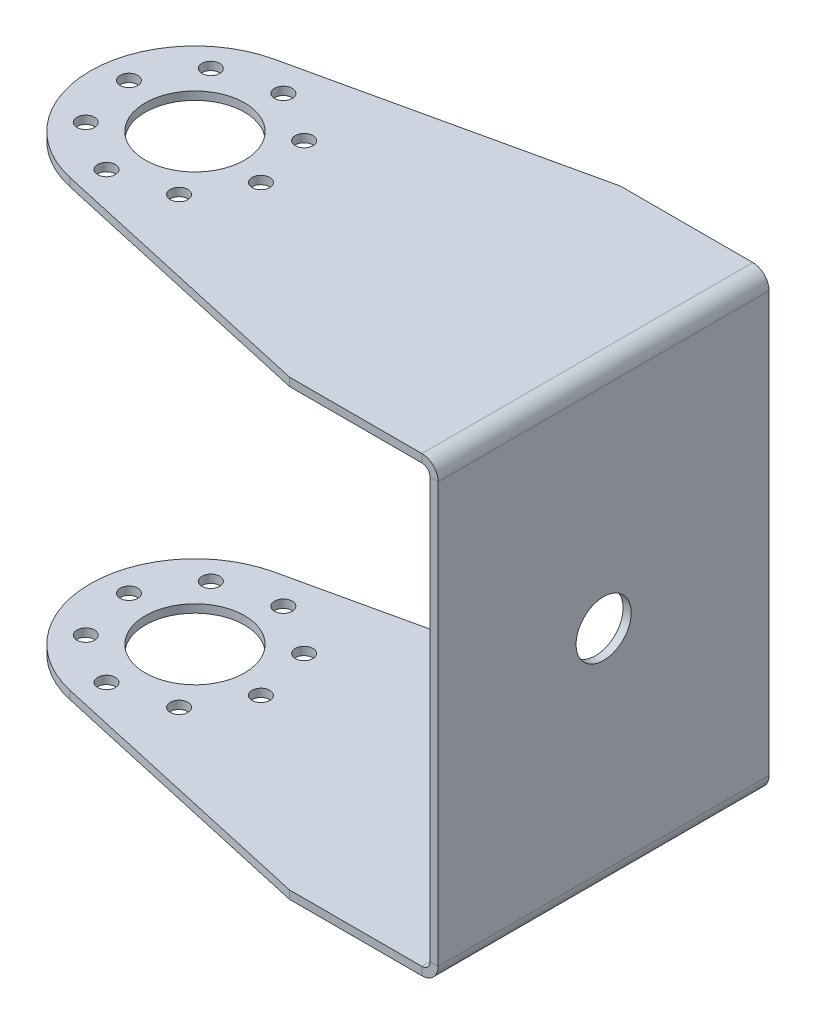
from build123d import *

# Parameters (mm, degrees)
T_LE_DE_BASE_PLI_E1_DEPTH = 30
ESQUISSE13_R              = 4.5
ESQUISSE13_R_2            = 0.8
ENL_V_MAT_EXTRU_2_DEPTH   = 72.281133549
SKETCH1_R                 = 2.5
CUT_EXTRUDE1_DEPTH        = 60.052053397


# Sheet-metal steps are written as plain solids
with BuildPart() as part:
    # Esquisse1 → Tôle de base pliée1 (new body)
    with BuildSketch(Plane.XY):
        with BuildLine():
            Line((-50, 20.5), (-1.4732, 20.5))
            ThreePointArc((-1.4732, 20.5), (-0.43149029, 20.06850971), (0, 19.0268))
            Line((0, 19.0268), (0, -19.0268))
            ThreePointArc((0, -19.0268), (-0.43149029, -20.06850971), (-1.4732, -20.5))
            Line((-1.4732, -20.5), (-50, -20.5))
            Line((-50, -20.5), (-50, -19.7634))
            Line((-50, -19.7634), (-1.4732, -19.7634))
            ThreePointArc((-1.4732, -19.7634), (-0.952345145, -19.547654855), (-0.7366, -19.0268))
            Line((-0.7366, -19.0268), (-0.7366, 19.0268))
            ThreePointArc((-0.7366, 19.0268), (-0.952345145, 19.547654855), (-1.4732, 19.7634))
            Line((-1.4732, 19.7634), (-50, 19.7634))
            Line((-50, 19.7634), (-50, 20.5))
        make_face()
    extrude(amount=T_LE_DE_BASE_PLI_E1_DEPTH)

    # Esquisse13 → Enlèv. mat.-Extru.2 (cut, through all)
    with BuildSketch(Plane.XZ.offset(20.5)):
        with BuildLine():
            ThreePointArc((-46.549919552, 15), (-44.463516741, 20.940418901), (-39.120745506, 24.271552182))
            Line((-39.120745506, 24.271552182), (-13.4732, 30))
            Line((-13.4732, 30), (-50, 30))
            Line((-50, 30), (-50, 15))
            Line((-50, 15), (-46.549919552, 15))
        make_face()
        with BuildLine():
            Line((-13.4732, 0), (-39.120745506, 5.728447818))
            ThreePointArc((-39.120745506, 5.728447818), (-44.463516741, 9.059581099), (-46.549919552, 15))
            Line((-46.549919552, 15), (-50, 15))
            Line((-50, 15), (-50, 0))
            Line((-50, 0), (-13.4732, 0))
        make_face()
        with Locations((-37.049919552, 15)):
            Circle(ESQUISSE13_R)
        with Locations((-30.049919552, 16.017866465)):
            Circle(ESQUISSE13_R_2)
        with Locations((-32.819912364, 20.669487748)):
            Circle(ESQUISSE13_R_2)
        with Locations((-38.067786017, 22)):
            Circle(ESQUISSE13_R_2)
        with Locations((-42.7194073, 19.230007189)):
            Circle(ESQUISSE13_R_2)
        with Locations((-44.049919552, 13.982133535)):
            Circle(ESQUISSE13_R_2)
        with Locations((-41.279926741, 9.330512252)):
            Circle(ESQUISSE13_R_2)
        with Locations((-36.032053088, 8)):
            Circle(ESQUISSE13_R_2)
        with Locations((-31.380431805, 10.769992811)):
            Circle(ESQUISSE13_R_2)
    extrude(amount=-ENL_V_MAT_EXTRU_2_DEPTH, mode=Mode.SUBTRACT)

    # Sketch1 → Cut-Extrude1 (cut, through all)
    with BuildSketch(Plane(origin=(0, 0, 0), x_dir=(0, 0, -1), z_dir=(1, 0, 0))):
        with Locations(Location((-15, 0, 0), (0, 0, 90))):
            Circle(SKETCH1_R)
    extrude(amount=-CUT_EXTRUDE1_DEPTH, mode=Mode.SUBTRACT)


solid = part.part
